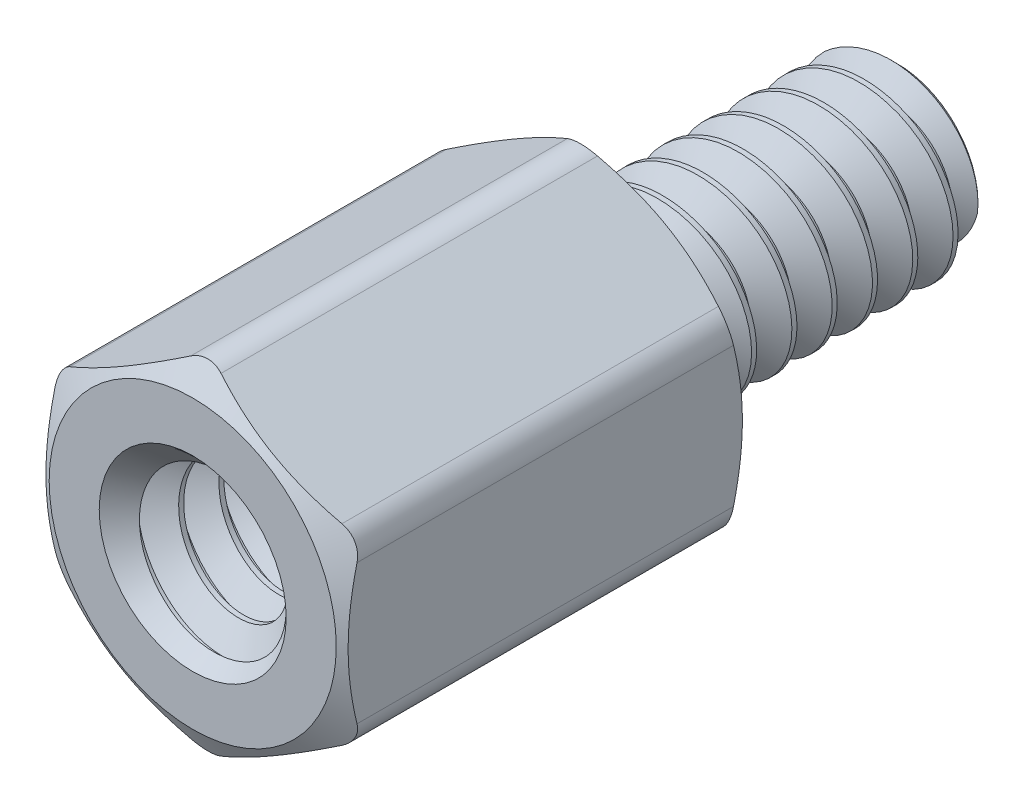
from build123d import *

# Parameters (mm, degrees)
SKETCH4_R           = 1.901825
BOSS_EXTRUDE1_DEPTH = 6.35
SKETCH5_OUTSIDE_W   = 53.388
SKETCH5_OUTSIDE_H   = 54.126
SKETCH5_OUTSIDE_R   = 2.2621875
CUT_EXTRUDE1_DEPTH  = 12.692667641
CUT_EXTRUDE1_DRAFT  = -60
SKETCH6_OUTSIDE_W   = 38.232
SKETCH6_OUTSIDE_H   = 38.97
SKETCH6_OUTSIDE_R   = 2.2621875
CUT_EXTRUDE2_DEPTH  = 8.318013413
CUT_EXTRUDE2_DRAFT  = -60
FILLET1_R           = 0.47625
CUT_SWEEP1_PITCH    = 0.635
SKETCH9_R           = 1.58115
BOSS_EXTRUDE2_DEPTH = 3.175
SKETCH10_W          = 3.175
SKETCH10_H          = 1.4224
CUT_SWEEP2_PITCH    = 0.635


with BuildPart() as part:
    # Sketch3 → Revolve1 (revolve)
    with BuildSketch(Plane(origin=(0, 0, 0), x_dir=(0, 0, -1), z_dir=(1, 0, 0))):
        with BuildLine():
            Line((-3.175, 1.26365), (-3.175, 0))
            Line((-3.175, 0), (4.7625, 0))
            Line((4.7625, 0), (4.7625, 1.26365))
            Line((4.7625, 1.26365), (4.60375, 1.4224))
            Line((4.60375, 1.4224), (0.809625, 1.4224))
            Line((0.809625, 1.4224), (0.5715, 1.009955401))
            Line((0.5715, 1.009955401), (0.15875, 1.009955401))
            ThreePointArc((0.15875, 1.009955401), (0.046496798, 1.0564522), (0, 1.168705401))
            Line((0, 1.168705401), (0, 2.38125))
            Line((0, 2.38125), (-6.35, 2.38125))
            Line((-6.35, 2.38125), (-6.35, 1.58115))
            Line((-6.35, 1.58115), (-6.19125, 1.4224))
            Line((-6.19125, 1.4224), (-3.33375, 1.4224))
            Line((-3.33375, 1.4224), (-3.175, 1.26365))
        make_face()
    revolve(axis=Axis((0, 0, -4.7625), (0, 0, 1)))

    # Sketch4 → Boss-Extrude1 (add)
    with BuildSketch(Plane.XY.offset(6.35)):
        Polygon((-2.38125, 1.374815329), (-2.38125, -1.374815329), (0, -2.749630657), (2.38125, -1.374815329), (2.38125, 1.374815329), (0, 2.749630657), align=None)
        Circle(SKETCH4_R, mode=Mode.SUBTRACT)
    extrude(amount=-BOSS_EXTRUDE1_DEPTH)


with BuildPart() as cut_extrude1_tool:
    # Sketch5 outside → Cut-Extrude1 (with draft: the straight prism first)
    with BuildSketch(Plane.XY.offset(6.35)):
        Rectangle(SKETCH5_OUTSIDE_W, SKETCH5_OUTSIDE_H)
        Circle(SKETCH5_OUTSIDE_R, mode=Mode.SUBTRACT)
    extrude(amount=-CUT_EXTRUDE1_DEPTH)
    # Cut-Extrude1: the draft: its side faces are tilted about the plane it starts from
    cut_extrude1_sides = [cut_extrude1_tool.faces().sort_by_distance(p)[0] for p in [
        (0, -27.063, 0.00366618),
        (26.694, 0, 0.00366618),
        (0, 27.063, 0.00366618),
        (-26.694, 0, 0.00366618),
        (-2.2621875, 0, 0.00366618),
    ]]
    draft(cut_extrude1_sides, Plane.XY.offset(6.35), CUT_EXTRUDE1_DRAFT)


with BuildPart() as part_1:
    add(part.part)

    # Cut-Extrude1: cut by cut_extrude1_tool
    add(cut_extrude1_tool.part, mode=Mode.SUBTRACT)


with BuildPart() as cut_extrude2_tool:
    # Sketch6 outside → Cut-Extrude2 (with draft: the straight prism first)
    with BuildSketch(Plane(origin=(0, 0, 0), x_dir=(-1, 0, 0), z_dir=(0, 0, -1))):
        Rectangle(SKETCH6_OUTSIDE_W, SKETCH6_OUTSIDE_H)
        Circle(SKETCH6_OUTSIDE_R, mode=Mode.SUBTRACT)
    extrude(amount=-CUT_EXTRUDE2_DEPTH)
    # Cut-Extrude2: the draft: its side faces are tilted about the plane it starts from
    cut_extrude2_sides = [cut_extrude2_tool.faces().sort_by_distance(p)[0] for p in [
        (0, -19.485, 4.159006706),
        (-19.116, 0, 4.159006706),
        (0, 19.485, 4.159006706),
        (19.116, 0, 4.159006706),
        (2.2621875, 0, 4.159006706),
    ]]
    draft(cut_extrude2_sides, Plane(origin=(0, 0, 0), x_dir=(-1, 0, 0), z_dir=(0, 0, -1)), CUT_EXTRUDE2_DRAFT)


with BuildPart() as part_2:
    add(part_1.part)

    # Cut-Extrude2: cut by cut_extrude2_tool
    add(cut_extrude2_tool.part, mode=Mode.SUBTRACT)

    # Fillet1
    fillet1_edges = [part_2.edges().sort_by_distance(p)[0] for p in [
        (0, 2.749630657, 3.175),
        (-2.38125, -1.374815329, 3.175),
        (0, -2.749630657, 3.175),
        (2.38125, -1.374815329, 3.175),
        (2.38125, 1.374815329, 3.175),
        (-2.38125, 1.374815329, 3.175),
    ]]
    fillet(fillet1_edges, radius=FILLET1_R)

    # Cut-Sweep1: the profile of Sketch7 profile screwed along a right-hand helix of 7.275 turns, 6 arcs to a turn; built about Z, then put on its axis
    cut_sweep1_z = Axis((0, 0, 0), (0, 0, 1))
    cut_sweep1_corners = [(1.009655401, 0, -0.238298205), (1.009655401, 0, -0.317326795), (1.456770383, 0, -0.57546875), (1.456770383, 0, 0.01984375)]
    with BuildLine(mode=Mode.PRIVATE) as cut_sweep1_profile:
        Line(cut_sweep1_corners[0], cut_sweep1_corners[1])
        Line(cut_sweep1_corners[1], cut_sweep1_corners[2])
        Line(cut_sweep1_corners[2], cut_sweep1_corners[3])
        Line(cut_sweep1_corners[3], cut_sweep1_corners[0])
    cut_sweep1_cap = Face(cut_sweep1_profile.wire())
    cut_sweep1_turn_angles = [0, 30, 60, 90, 120, 150, 180, 210, 240, 270, 300, 330, 360]
    cut_sweep1_turn_weights = [1, 0.8660254037844387, 1, 0.8660254037844387, 1, 0.8660254037844387, 1, 0.8660254037844387, 1, 0.8660254037844387, 1, 0.8660254037844387, 1]
    cut_sweep1_turn_rails = [Edge.make_bspline([Vector(p[0], p[1], 0).rotate(cut_sweep1_z, cut_sweep1_turn_angles[k]) / cut_sweep1_turn_weights[k] + Vector(0, 0, p[2] + CUT_SWEEP1_PITCH * cut_sweep1_turn_angles[k] / 360) for k in range(13)], [0, 0, 0, 1, 1, 2, 2, 3, 3, 4, 4, 5, 5, 6, 6, 6], 2, cut_sweep1_turn_weights) for p in cut_sweep1_corners]
    cut_sweep1_turn_sides = [Face.make_surface_from_curves(cut_sweep1_turn_rails[p[0]], cut_sweep1_turn_rails[p[1]]) for p in [(0, 1), (1, 2), (2, 3), (3, 0)]]
    cut_sweep1_last_angles = [2520, 2550, 2580, 2599.5, 2619]
    cut_sweep1_last_weights = [1, 0.8660254037844387, 1, 0.9426414910921863, 1]
    cut_sweep1_last_rails = [Edge.make_bspline([Vector(p[0], p[1], 0).rotate(cut_sweep1_z, cut_sweep1_last_angles[k]) / cut_sweep1_last_weights[k] + Vector(0, 0, p[2] + CUT_SWEEP1_PITCH * cut_sweep1_last_angles[k] / 360) for k in range(5)], [0, 0, 0, 1, 1, 2, 2, 2], 2, cut_sweep1_last_weights) for p in cut_sweep1_corners]
    cut_sweep1_last_sides = [Face.make_surface_from_curves(cut_sweep1_last_rails[p[0]], cut_sweep1_last_rails[p[1]]) for p in [(0, 1), (1, 2), (2, 3), (3, 0)]]
    cut_sweep1 = Plane(origin=(0, 0, -4.7625), x_dir=(0, 1, 0), z_dir=(0, 0, 1)) * Solid(Shell([*[p.moved(Location((0, 0, CUT_SWEEP1_PITCH * i))) for i in range(7) for p in cut_sweep1_turn_sides], *cut_sweep1_last_sides, cut_sweep1_cap, cut_sweep1_cap.rotate(cut_sweep1_z, 2619).moved(Location((0, 0, CUT_SWEEP1_PITCH * 2619 / 360)))]))
    add(cut_sweep1, mode=Mode.SUBTRACT)

    # Sketch9 → Boss-Extrude2 (add)
    with BuildSketch(Plane.XY.offset(3.175)):
        Circle(SKETCH9_R)
    extrude(amount=BOSS_EXTRUDE2_DEPTH)


with BuildPart() as body_2:
    # Sketch10 → Revolve2 (revolve)
    with BuildSketch(Plane(origin=(0, 0, 0), x_dir=(0, 0, -1), z_dir=(1, 0, 0))):
        with Locations((-4.7625, 0.7112)):
            Rectangle(SKETCH10_W, SKETCH10_H)
    revolve(axis=Axis((0, 0, -4.7625), (0, 0, 1)))

    # Cut-Sweep2: the profile of Sketch12 profile screwed along a right-hand helix of 6 turns, 6 arcs to a turn; built about Z, then put on its axis
    cut_sweep2_z = Axis((0, 0, 0), (0, 0, 1))
    cut_sweep2_corners = [(1.009655401, 0, -0.317326795), (1.009655401, 0, -0.238298205), (1.456770383, 0, 0.01984375), (1.456770383, 0, -0.57546875)]
    with BuildLine(mode=Mode.PRIVATE) as cut_sweep2_profile:
        Line(cut_sweep2_corners[0], cut_sweep2_corners[1])
        Line(cut_sweep2_corners[1], cut_sweep2_corners[2])
        Line(cut_sweep2_corners[2], cut_sweep2_corners[3])
        Line(cut_sweep2_corners[3], cut_sweep2_corners[0])
    cut_sweep2_cap = Face(cut_sweep2_profile.wire())
    cut_sweep2_turn_angles = [0, 30, 60, 90, 120, 150, 180, 210, 240, 270, 300, 330, 360]
    cut_sweep2_turn_weights = [1, 0.8660254037844387, 1, 0.8660254037844387, 1, 0.8660254037844387, 1, 0.8660254037844387, 1, 0.8660254037844387, 1, 0.8660254037844387, 1]
    cut_sweep2_turn_rails = [Edge.make_bspline([Vector(p[0], p[1], 0).rotate(cut_sweep2_z, cut_sweep2_turn_angles[k]) / cut_sweep2_turn_weights[k] + Vector(0, 0, p[2] + CUT_SWEEP2_PITCH * cut_sweep2_turn_angles[k] / 360) for k in range(13)], [0, 0, 0, 1, 1, 2, 2, 3, 3, 4, 4, 5, 5, 6, 6, 6], 2, cut_sweep2_turn_weights) for p in cut_sweep2_corners]
    cut_sweep2_turn_sides = [Face.make_surface_from_curves(cut_sweep2_turn_rails[p[0]], cut_sweep2_turn_rails[p[1]]) for p in [(0, 1), (1, 2), (2, 3), (3, 0)]]
    cut_sweep2 = Plane(origin=(0, 0, 6.35), x_dir=(0, 1, 0), z_dir=(0, 0, -1)) * Solid(Shell([*[p.moved(Location((0, 0, CUT_SWEEP2_PITCH * i))) for i in range(6) for p in cut_sweep2_turn_sides], cut_sweep2_cap, cut_sweep2_cap.rotate(cut_sweep2_z, 2160).moved(Location((0, 0, CUT_SWEEP2_PITCH * 2160 / 360)))]))
    add(cut_sweep2, mode=Mode.SUBTRACT)


with BuildPart() as part_3:
    add(part_2.part)

    # Combine1: cut body 2
    add(body_2.part, mode=Mode.SUBTRACT)

    # Cut-Extrude3 cone 1 section (through the dimple's axis) → Cut-Extrude3 (revolve, cut)
    with BuildSketch(Plane(origin=(0, 0, 6.35), x_dir=(0, -1, 0), z_dir=(1, 0, 0))):
        Polygon((0, 0), (1.4732, 0), (0, 1.4732), align=None)
    revolve(axis=Axis((0, 0, 6.35), (0, 0, -1)), mode=Mode.SUBTRACT)


solid = part_3.part
